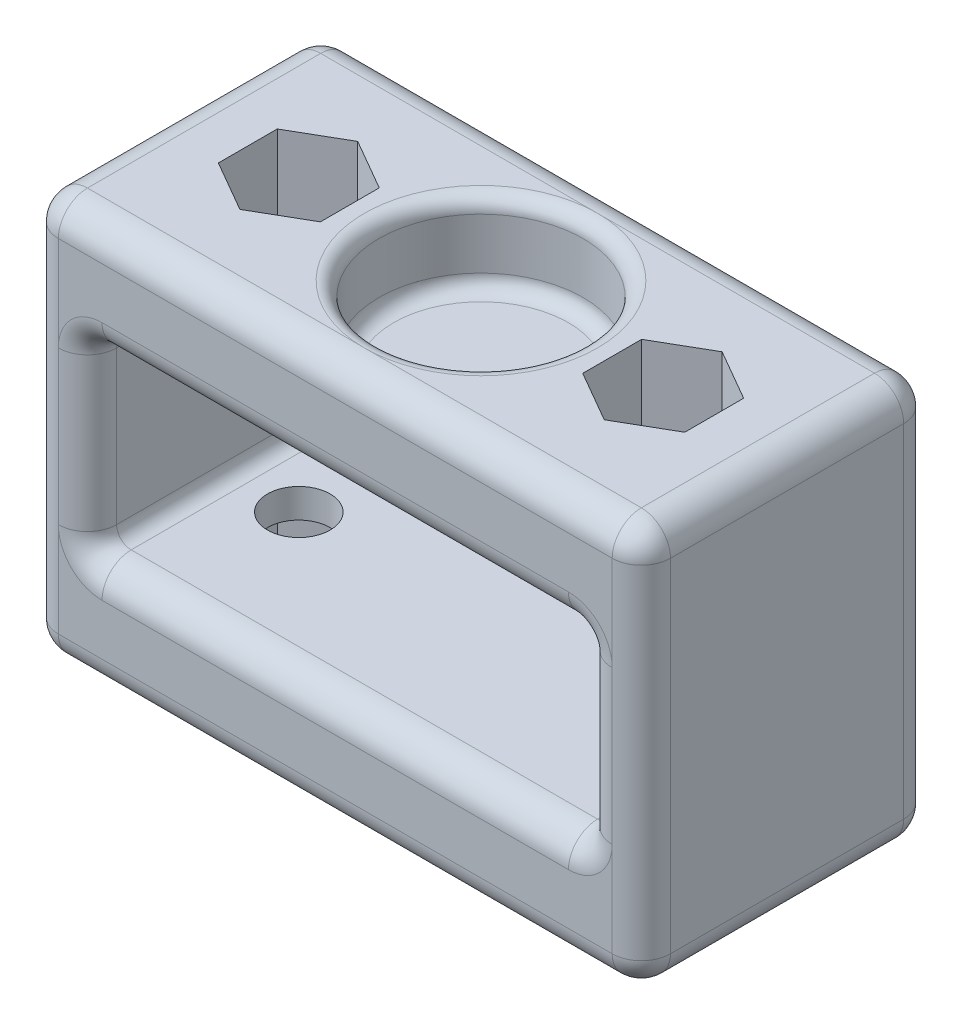
from build123d import *

# Parameters (mm, degrees)
SKETCH_1_W               = 42
SKETCH_1_H               = 27.5
EXTRUDE_1_DEPTH          = 10
CUT_EXTRUDE_1_DEPTH      = 37.017356927
CUT_EXTRUDE_1_DEPTH_BACK = 37.017356927
SKETCH_2_R               = 2.15
SKETCH_3_R               = 7
CUT_EXTRUDE_2_DEPTH      = 5.5
CUT_EXTRUDE_4_DEPTH      = 28.019668762
CUT_EXTRUDE_4_DEPTH_BACK = 28.019668762
FILLET_1_R               = 2
FILLET_3_R               = 1


with BuildPart() as part:
    # 草图1 → 凸台-拉伸1 (new, symmetric)
    with BuildSketch(Plane.XY):
        Rectangle(SKETCH_1_W, SKETCH_1_H)
    extrude(amount=EXTRUDE_1_DEPTH, both=True)

    # 草图2 → 切除-拉伸1 (cut, two sides: drawn at the far end of the back side and taken through both)
    with BuildSketch(Plane(origin=(0, 13.75, 0), x_dir=(1, 0, 0), z_dir=(0, 1, 0)).offset(-CUT_EXTRUDE_1_DEPTH_BACK)):
        with Locations(Location((-12.5, 0, 0), (0, 0, 180))):
            Circle(SKETCH_2_R)
        with Locations(Location((12.5, 0, 0), (0, 0, 180))):
            Circle(SKETCH_2_R)
    extrude(amount=CUT_EXTRUDE_1_DEPTH + CUT_EXTRUDE_1_DEPTH_BACK, mode=Mode.SUBTRACT)

    # 草图3 → 切除-拉伸2 (cut)
    with BuildSketch(Plane(origin=(0, 13.75, 0), x_dir=(1, 0, 0), z_dir=(0, 1, 0))):
        with Locations(Location((0, 0, 0), (0, 0, 180))):
            Circle(SKETCH_3_R)
        Polygon((-9, -2.020725942), (-9, 2.020725942), (-12.5, 4.041451884), (-16, 2.020725942), (-16, -2.020725942), (-12.5, -4.041451884), align=None)
        Polygon((12.5, -4.041451884), (9, -2.020725942), (9, 2.020725942), (12.5, 4.041451884), (16, 2.020725942), (16, -2.020725942), align=None)
    cut_extrude_2 = extrude(amount=-CUT_EXTRUDE_2_DEPTH, mode=Mode.SUBTRACT)

    # 镜向2: 切除-拉伸2 across plane
    add(cut_extrude_2.mirror(Plane.ZX), mode=Mode.SUBTRACT)

    # 草图5 → 切除-拉伸4 (cut, two sides: drawn at the far end of the back side and taken through both)
    with BuildSketch(Plane.XY.offset(-CUT_EXTRUDE_4_DEPTH_BACK)):
        with BuildLine():
            Line((16, -6.25), (-16, -6.25))
            ThreePointArc((-16, -6.25), (-16.707106781, -5.957106781), (-17, -5.25))
            Line((-17, -5.25), (-17, 5.25))
            ThreePointArc((-17, 5.25), (-16.707106781, 5.957106781), (-16, 6.25))
            Line((-16, 6.25), (16, 6.25))
            ThreePointArc((16, 6.25), (16.707106781, 5.957106781), (17, 5.25))
            Line((17, 5.25), (17, -5.25))
            ThreePointArc((17, -5.25), (16.707106781, -5.957106781), (16, -6.25))
        make_face()
    extrude(amount=CUT_EXTRUDE_4_DEPTH + CUT_EXTRUDE_4_DEPTH_BACK, mode=Mode.SUBTRACT)

    # 圆角1
    fillet_1_edges = [part.edges().sort_by_distance(p)[0] for p in [
        (0, -6.25, -10),
        (0, 6.25, -10),
        (16.707106781, -5.957106781, -10),
        (-16.707106781, -5.957106781, -10),
        (-17, 0, -10),
        (-16.707106781, 5.957106781, -10),
        (16.707106781, 5.957106781, -10),
        (17, 0, -10),
        (16.707106781, -5.957106781, 10),
        (17, 0, 10),
        (16.707106781, 5.957106781, 10),
        (0, 6.25, 10),
        (-16.707106781, 5.957106781, 10),
        (-17, 0, 10),
        (-16.707106781, -5.957106781, 10),
        (0, -6.25, 10),
        (21, 0, 10),
        (0, 13.75, 10),
        (-21, 0, 10),
        (0, 13.75, -10),
        (21, 0, -10),
        (0, -13.75, -10),
        (-21, 0, -10),
        (-21, 13.75, 0),
        (21, 13.75, 0),
        (21, -13.75, 0),
        (-21, -13.75, 0),
        (0, -13.75, 10),
    ]]
    fillet(fillet_1_edges, radius=FILLET_1_R - 0.0001)  # a hair under: the kernel refuses the full size

    # 圆角3
    fillet_3_edges = [part.edges().sort_by_distance(p)[0] for p in [
        (7, 8.25, 0),
        (7, 13.75, 0),
        (7, -13.75, 0),
        (7, -8.25, 0),
    ]]
    fillet(fillet_3_edges, radius=FILLET_3_R)


solid = part.part
